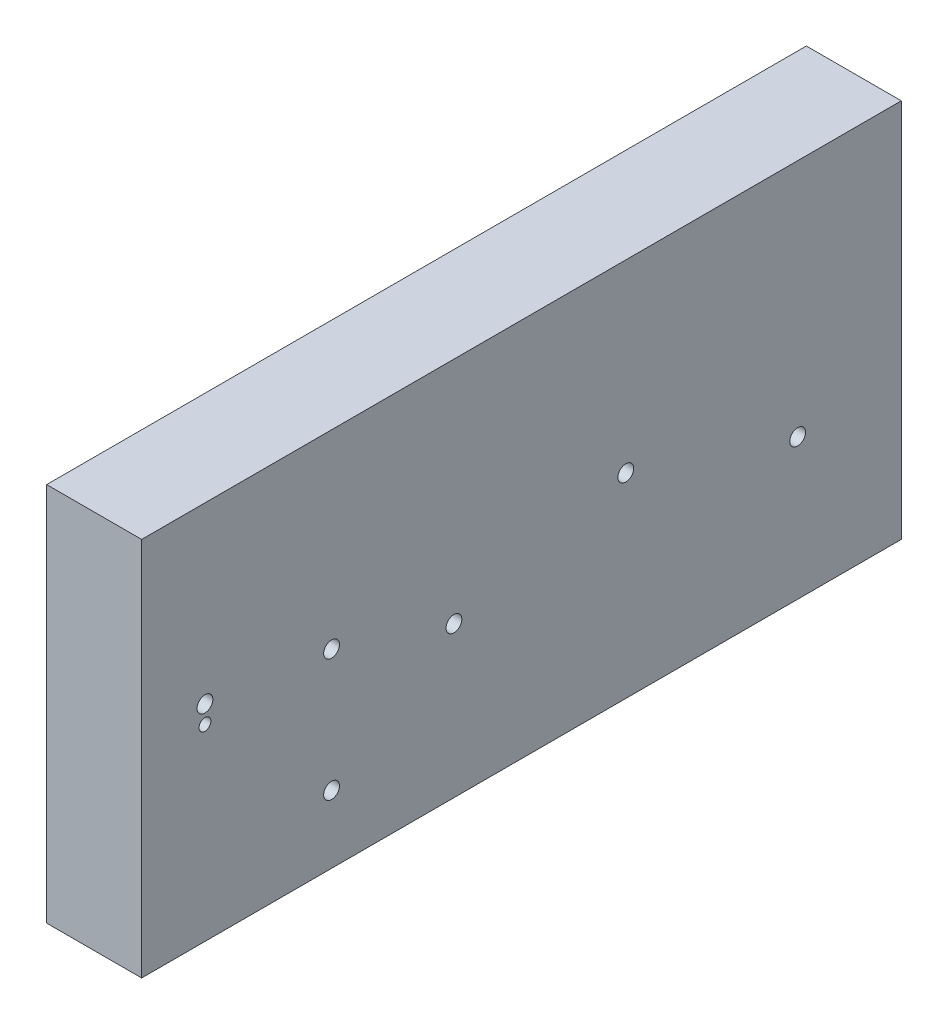
from build123d import *

# Parameters (mm, degrees)
SKETCH1_W                       = 152.4
SKETCH1_H                       = 76.2
SKETCH1_R                       = 1.5875
SKETCH1_R_2                     = 1.190625
BOSS_EXTRUDE1_DEPTH             = 19.05
F_1_4_0_25_DIAMETER_HOLE2_D     = 6.35
F_1_4_0_25_DIAMETER_HOLE2_DEPTH = 12.7
F_1_4_0_25_DIAMETER_HOLE2_TIP   = 1.907732465


with BuildPart() as part:
    # Sketch1 → Boss-Extrude1 (new body)
    with BuildSketch(Plane(origin=(0, 0, 0), x_dir=(0, 0, -1), z_dir=(1, 0, 0))):
        Rectangle(SKETCH1_W, SKETCH1_H)
        with Locations((20.927, 1.096077564)):
            Circle(SKETCH1_R, mode=Mode.SUBTRACT)
        with Locations((-38.1, 0)):
            Circle(SKETCH1_R, mode=Mode.SUBTRACT)
        with Locations((-63.5, 3.175)):
            Circle(SKETCH1_R, mode=Mode.SUBTRACT)
        with Locations((-38.1, -24.55595238)):
            Circle(SKETCH1_R, mode=Mode.SUBTRACT)
        with Locations((-13.55, -7.860160556)):
            Circle(SKETCH1_R, mode=Mode.SUBTRACT)
        with Locations((55.404, -9.873506796)):
            Circle(SKETCH1_R, mode=Mode.SUBTRACT)
        with Locations((-63.5, -0.396875)):
            Circle(SKETCH1_R_2, mode=Mode.SUBTRACT)
    extrude(amount=BOSS_EXTRUDE1_DEPTH)

    # 1/4 (0.25) Diameter Hole2
    with Locations(Plane.XZ.offset(38.1)):
        with Locations((9.525, 57.15), (9.525, -63.5), (9.525, 0)):
            Hole(F_1_4_0_25_DIAMETER_HOLE2_D / 2, depth=F_1_4_0_25_DIAMETER_HOLE2_DEPTH)
            with Locations((0, 0, -(F_1_4_0_25_DIAMETER_HOLE2_DEPTH + F_1_4_0_25_DIAMETER_HOLE2_TIP / 2))):  # 118° drill point
                Cone(0, F_1_4_0_25_DIAMETER_HOLE2_D / 2, F_1_4_0_25_DIAMETER_HOLE2_TIP, mode=Mode.SUBTRACT)


solid = part.part
